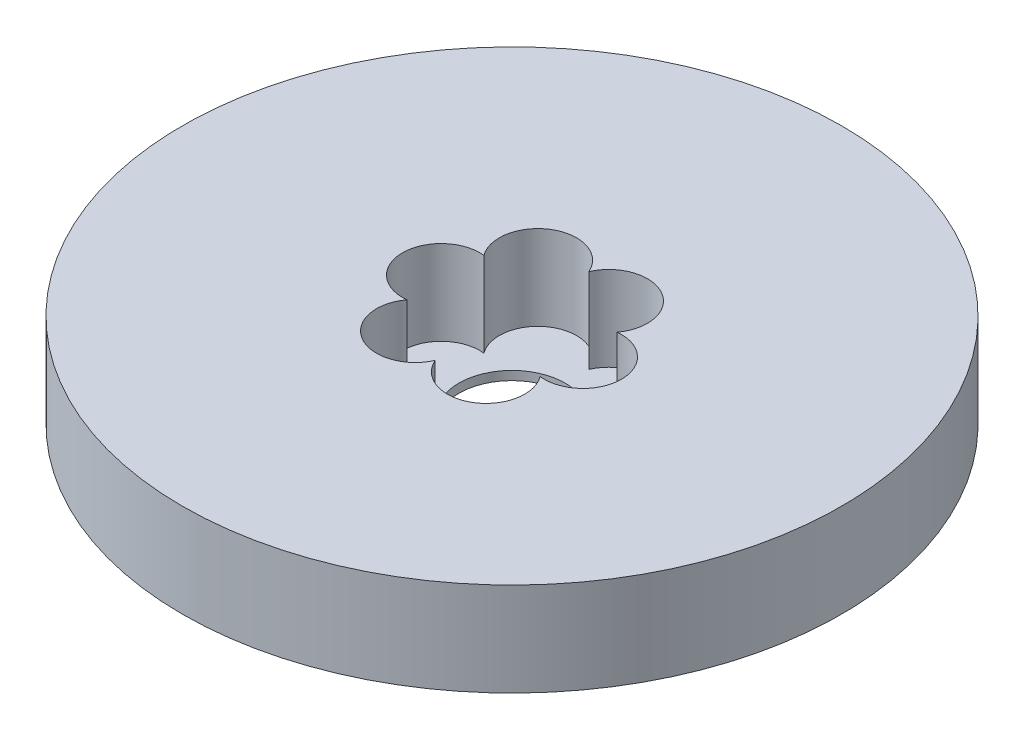
from build123d import *

# Parameters (mm, degrees)
SKETCH1_R           = 77.5
BOSS_EXTRUDE1_DEPTH = 22
SKETCH2_R           = 12.5
CUT_EXTRUDE1_DEPTH  = 112.787745303
SKETCH3_R           = 9.094540672
CUT_EXTRUDE2_DEPTH  = 19.91553476
CIRPATTERN1_COUNT   = 6


with BuildPart() as part:
    # Sketch1 → Boss-Extrude1 (new body)
    with BuildSketch(Plane(origin=(0, 0, 0), x_dir=(1, 0, 0), z_dir=(0, 1, 0))):
        Circle(SKETCH1_R)
    extrude(amount=BOSS_EXTRUDE1_DEPTH)

    # Sketch2 → Cut-Extrude1 (cut, through all)
    with BuildSketch(Plane(origin=(0, 0, 0), x_dir=(1, 0, 0), z_dir=(0, 1, 0))):
        Circle(SKETCH2_R)
    extrude(amount=CUT_EXTRUDE1_DEPTH, mode=Mode.SUBTRACT)

    # Sketch3 → Cut-Extrude2 (cut)
    with BuildSketch(Plane(origin=(0, 22, 0), x_dir=(1, 0, 0), z_dir=(0, 1, 0))):
        with Locations((-16.662496282, 0)):
            Circle(SKETCH3_R)
    cut_extrude2 = extrude(amount=-CUT_EXTRUDE2_DEPTH, mode=Mode.SUBTRACT)

    # CirPattern1: Cut-Extrude2 ×6 about axis
    cirpattern1_axis = Axis((0, 0, 0), (0, 1, 0))
    for i in range(1, CIRPATTERN1_COUNT):
        add(cut_extrude2.rotate(cirpattern1_axis, i * 360 / CIRPATTERN1_COUNT), mode=Mode.SUBTRACT)


solid = part.part
